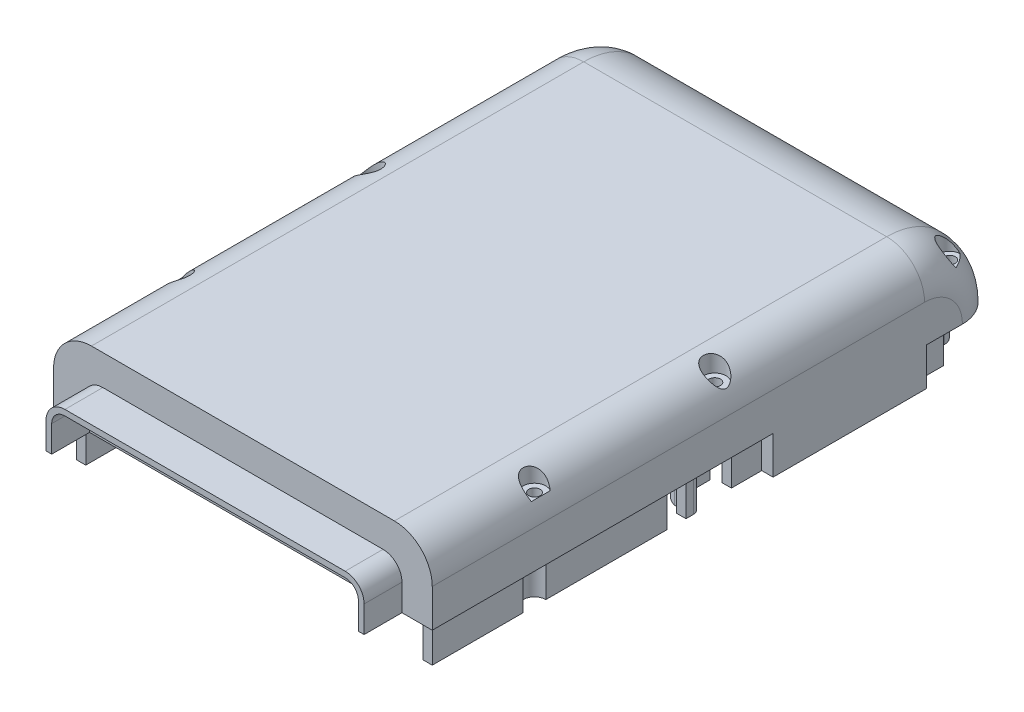
from build123d import *

# Parameters (mm, degrees)
SKETCH_1_W                  = 100
SKETCH_1_H                  = 150
EXTRUDE_1_DEPTH             = 20
FILLET_1_R                  = 10
FILLET_2_R                  = 20
SHELL_6_T                   = -3
SKETCH_5_W                  = 3
SKETCH_5_H                  = 40.5
EXTRUDE_2_DEPTH             = 10
SKETCH_6_W                  = 2.5
SKETCH_6_H                  = 56
EXTRUDE_3_DEPTH             = 10
EXTRUDE_3_DIRECTION_2_REACH = 94.331
EXTRUDE_4_DEPTH             = 11
EXTRUDE_4_DIRECTION_2_REACH = 94.331
EXTRUDE_13_REACH            = 94.331
SKETCH_23_R                 = 3
EXTRUDE_5_REACH             = 94.331
EXTRUDE_6_REACH             = 94.331
CUT_EXTRUDE_1_DEPTH         = 10
CUT_EXTRUDE_1_DEPTH_BACK    = 93.330926563
SKETCH_11_R                 = 1.5
SKETCH_11_R_2               = 1.485350611
EXTRUDE_7_DEPTH             = 10
SKETCH_15_R                 = 3
CUT_EXTRUDE_4_DEPTH         = 5
SKETCH_16_R                 = 2.8
CUT_EXTRUDE_5_DEPTH         = 8
EXTRUDE_11_DEPTH            = 3
SKETCH_19_W                 = 10
SKETCH_19_H                 = 3
EXTRUDE_9_DEPTH             = 12
CUT_EXTRUDE_6_REACH         = 152.603
SKETCH_21_W                 = 1.5
SKETCH_21_H                 = 16.986459988
SKETCH_21_H_2               = 18.55
EXTRUDE_10_DEPTH            = 1.5
SKETCH_25_R                 = 12.6
SKETCH_25_R_2               = 9.6
EXTRUDE_14_DEPTH            = 10
CUT_EXTRUDE_8_DEPTH         = 1


with BuildPart() as part:
    # 草图1 → 凸台-拉伸1 (new body)
    with BuildSketch(Plane(origin=(0, 0, 0), x_dir=(1, 0, 0), z_dir=(0, 1, 0))):
        Rectangle(SKETCH_1_W, SKETCH_1_H)
    extrude(amount=EXTRUDE_1_DEPTH)

    # 圆角1
    fillet_1_edges = [part.edges().sort_by_distance(p)[0] for p in [
        (50, 20, 0),
        (-50, 20, 0),
        (-50, 10, -75),
        (50, 10, -75),
    ]]
    fillet(fillet_1_edges, radius=FILLET_1_R)

    # 圆角2
    # the kernel refuses this fillet: 20 mm, written as the material it takes off along each edge
    with BuildSketch(Plane(origin=(-50, 0, -55), x_dir=(0, 1, 0), z_dir=(0, 0, 1))) as fillet_2_piece_1:
        with BuildLine():
            CenterArc((10, -10), 10, 0, 90)
            Line((20, -10), (20, 0))
            Line((20, 0), (10, 0))
        make_face()
    revolve(axis=Axis((-50, 0, -55), (-1, 0, 0)), revolution_arc=90, mode=Mode.SUBTRACT)
    with BuildSketch(Plane(origin=(50, 0, -55), x_dir=(0, 0, -1), z_dir=(0, -1, 0))) as fillet_2_piece_2:
        with BuildLine():
            CenterArc((10, -10), 10, 0, 90)
            Line((20, -10), (20, 0))
            Line((20, 0), (10, 0))
        make_face()
    revolve(axis=Axis((50, 0, -55), (1, 0, 0)), revolution_arc=90, mode=Mode.SUBTRACT)
    with BuildSketch(Plane(origin=(50, 20, -75), x_dir=(0, -1, 0), z_dir=(-1, 0, 0))) as fillet_2_piece_3:
        with BuildLine():
            CenterArc((FILLET_2_R, FILLET_2_R), FILLET_2_R, 180, 90)
            Line((0, FILLET_2_R), (0, 0))
            Line((0, 0), (FILLET_2_R, 0))
        make_face()
    extrude(amount=100, mode=Mode.SUBTRACT)

    # 抽壳6
    shell_6_openings = [part.faces().sort_by_distance(p)[0] for p in [
        (0, 0, 0.208807955),
    ]]
    offset(amount=SHELL_6_T, openings=shell_6_openings)

    # 草图5 → 凸台-拉伸2 (add)
    with BuildSketch(Plane.XZ):
        with Locations((48.5, -35.25)):
            Rectangle(SKETCH_5_W, SKETCH_5_H)
        with Locations((-48.5, -35.25)):
            Rectangle(SKETCH_5_W, SKETCH_5_H)
    extrude(amount=EXTRUDE_2_DEPTH)

    # 草图6 → 凸台-拉伸3 (add)
    with BuildSketch(Plane.XZ):
        with Locations((45.75, -35)):
            Rectangle(SKETCH_6_W, SKETCH_6_H)
        with Locations((-45.75, -35)):
            Rectangle(SKETCH_6_W, SKETCH_6_H)
    extrude(amount=EXTRUDE_3_DEPTH)

    # 草图6 → 凸台-拉伸3 direction 2 (add, up to next)
    with BuildSketch(Plane.XZ, mode=Mode.PRIVATE) as extrude_3_direction_2_sk1:
        with Locations((45.75, -35)):
            Rectangle(SKETCH_6_W, SKETCH_6_H)
    extrude_3_direction_2_tool1 = extrude(extrude_3_direction_2_sk1.sketch, amount=-EXTRUDE_3_DIRECTION_2_REACH, mode=Mode.PRIVATE) - part.part
    # 草图6 → 凸台-拉伸3 direction 2 (add, up to next)
    with BuildSketch(Plane.XZ, mode=Mode.PRIVATE) as extrude_3_direction_2_sk2:
        with Locations((-45.75, -35)):
            Rectangle(SKETCH_6_W, SKETCH_6_H)
    extrude_3_direction_2_tool2 = extrude(extrude_3_direction_2_sk2.sketch, amount=-EXTRUDE_3_DIRECTION_2_REACH, mode=Mode.PRIVATE) - part.part
    add(extrude_3_direction_2_tool1.solids().sort_by_distance((45.75, 0, -35))[0])
    add(extrude_3_direction_2_tool2.solids().sort_by_distance((-45.75, 0, -35))[0])

    # 草图7 → 凸台-拉伸4 (add)
    with BuildSketch(Plane.XZ):
        with BuildLine():
            Line((-47, 39.5), (-47, 10.051578841))
            Line((-47, 10.051578841), (-44.5, 10))
            Line((-44.5, 10), (-44.5, 40.101020514))
            ThreePointArc((-44.5, 40.101020514), (-41.5, 45), (-44.5, 49.898979486))
            Line((-44.5, 49.898979486), (-44.5, 72))
            Line((-44.5, 72), (-47, 72))
            Line((-47, 72), (-47, 50.5))
            Line((-47, 50.5), (-47, 48))
            ThreePointArc((-47, 48), (-44, 45), (-47, 42))
            Line((-47, 42), (-47, 39.5))
        make_face()
        with BuildLine():
            Line((47, 72), (44.5, 72))
            Line((44.5, 72), (44.5, 69))
            Line((44.5, 69), (44.5, 49.898979486))
            ThreePointArc((44.5, 49.898979486), (41.5, 45), (44.5, 40.101020514))
            Line((44.5, 40.101020514), (44.5, 10))
            Line((44.5, 10), (47, 10.051578841))
            Line((47, 10.051578841), (47, 39.5))
            Line((47, 39.5), (47, 42))
            ThreePointArc((47, 42), (44, 45), (47, 48))
            Line((47, 48), (47, 50.5))
            Line((47, 50.5), (47, 72))
        make_face()
        with BuildLine():
            Line((47, 3), (47, 5))
            Line((47, 5), (44.485471899, 5))
            ThreePointArc((44.485471899, 5), (43.979696953, 4.052146831), (43.061891595, 3.493696072))
            ThreePointArc((43.061891595, 3.493696072), (42.750579363, 3.430103155), (42.433163974, 3.41572138))
            ThreePointArc((42.433163974, 3.41572138), (39.8250351, 1.859129053), (38.8, -1))
            Line((38.8, -1), (38.8, -7))
            Line((38.8, -7), (41.3, -7))
            Line((41.3, -7), (41.3, -1))
            ThreePointArc((41.3, -1), (41.885786438, 0.414213562), (43.3, 1))
            Line((43.3, 1), (45, 1))
            ThreePointArc((45, 1), (46.414213562, 1.585786438), (47, 3))
        make_face()
        with BuildLine():
            Line((-44.485471899, 5), (-47, 5))
            Line((-47, 5), (-47, 3))
            ThreePointArc((-47, 3), (-46.414213562, 1.585786438), (-45, 1))
            Line((-45, 1), (-43.3, 1))
            ThreePointArc((-43.3, 1), (-41.885786438, 0.414213562), (-41.3, -1))
            Line((-41.3, -1), (-41.3, -7))
            Line((-41.3, -7), (-38.8, -7))
            Line((-38.8, -7), (-38.8, -1))
            ThreePointArc((-38.8, -1), (-39.8250351, 1.859129053), (-42.433163974, 3.41572138))
            ThreePointArc((-42.433163974, 3.41572138), (-42.750579363, 3.430103155), (-43.061891595, 3.493696072))
            ThreePointArc((-43.061891595, 3.493696072), (-43.979696953, 4.052146831), (-44.485471899, 5))
        make_face()
        Polygon((-13.6, -12), (-13.6, -58.5), (-31.6, -58.5), (-31.6, -61), (-11.1, -61), (-11.1, -9.5), (-31.6, -9.5), (-31.6, -12), align=None)
        Polygon((31.6, -61), (11.1, -61), (11.1, -9.5), (31.6, -9.5), (31.6, -12), (13.6, -12), (13.6, -58.5), (31.6, -58.5), align=None)
        with BuildLine():
            Line((38.3, -69.5), (0, -69.5))
            Line((0, -69.5), (0, -72))
            Line((0, -72), (38.3, -72))
            ThreePointArc((38.3, -72), (40.421320344, -71.121320344), (41.3, -69))
            Line((41.3, -69), (41.3, -63.5))
            Line((41.3, -63.5), (38.8, -63.5))
            Line((38.8, -63.5), (38.8, -69))
            ThreePointArc((38.8, -69), (38.653553391, -69.353553391), (38.3, -69.5))
        make_face()
        with BuildLine():
            Line((0, -72), (0, -69.5))
            Line((0, -69.5), (-38.3, -69.5))
            ThreePointArc((-38.3, -69.5), (-38.653553391, -69.353553391), (-38.8, -69))
            Line((-38.8, -69), (-38.8, -63.5))
            Line((-38.8, -63.5), (-41.3, -63.5))
            Line((-41.3, -63.5), (-41.3, -69))
            ThreePointArc((-41.3, -69), (-40.421320344, -71.121320344), (-38.3, -72))
            Line((-38.3, -72), (0, -72))
        make_face()
    extrude(amount=EXTRUDE_4_DEPTH)

    # 草图7 → 凸台-拉伸4 direction 2 (add, up to next)
    with BuildSketch(Plane.XZ, mode=Mode.PRIVATE) as extrude_4_direction_2_sk1:
        with BuildLine():
            Line((-47, 39.5), (-47, 10.051578841))
            Line((-47, 10.051578841), (-44.5, 10))
            Line((-44.5, 10), (-44.5, 40.101020514))
            ThreePointArc((-44.5, 40.101020514), (-41.5, 45), (-44.5, 49.898979486))
            Line((-44.5, 49.898979486), (-44.5, 72))
            Line((-44.5, 72), (-47, 72))
            Line((-47, 72), (-47, 50.5))
            Line((-47, 50.5), (-47, 48))
            ThreePointArc((-47, 48), (-44, 45), (-47, 42))
            Line((-47, 42), (-47, 39.5))
        make_face()
    extrude_4_direction_2_tool1 = extrude(extrude_4_direction_2_sk1.sketch, amount=-EXTRUDE_4_DIRECTION_2_REACH, mode=Mode.PRIVATE) - part.part
    # 草图7 → 凸台-拉伸4 direction 2 (add, up to next)
    with BuildSketch(Plane.XZ, mode=Mode.PRIVATE) as extrude_4_direction_2_sk2:
        with BuildLine():
            Line((47, 72), (44.5, 72))
            Line((44.5, 72), (44.5, 69))
            Line((44.5, 69), (44.5, 49.898979486))
            ThreePointArc((44.5, 49.898979486), (41.5, 45), (44.5, 40.101020514))
            Line((44.5, 40.101020514), (44.5, 10))
            Line((44.5, 10), (47, 10.051578841))
            Line((47, 10.051578841), (47, 39.5))
            Line((47, 39.5), (47, 42))
            ThreePointArc((47, 42), (44, 45), (47, 48))
            Line((47, 48), (47, 50.5))
            Line((47, 50.5), (47, 72))
        make_face()
    extrude_4_direction_2_tool2 = extrude(extrude_4_direction_2_sk2.sketch, amount=-EXTRUDE_4_DIRECTION_2_REACH, mode=Mode.PRIVATE) - part.part
    # 草图7 → 凸台-拉伸4 direction 2 (add, up to next)
    with BuildSketch(Plane.XZ, mode=Mode.PRIVATE) as extrude_4_direction_2_sk3:
        with BuildLine():
            Line((47, 3), (47, 5))
            Line((47, 5), (44.485471899, 5))
            ThreePointArc((44.485471899, 5), (43.979696953, 4.052146831), (43.061891595, 3.493696072))
            ThreePointArc((43.061891595, 3.493696072), (42.750579363, 3.430103155), (42.433163974, 3.41572138))
            ThreePointArc((42.433163974, 3.41572138), (39.8250351, 1.859129053), (38.8, -1))
            Line((38.8, -1), (38.8, -7))
            Line((38.8, -7), (41.3, -7))
            Line((41.3, -7), (41.3, -1))
            ThreePointArc((41.3, -1), (41.885786438, 0.414213562), (43.3, 1))
            Line((43.3, 1), (45, 1))
            ThreePointArc((45, 1), (46.414213562, 1.585786438), (47, 3))
        make_face()
    extrude_4_direction_2_tool3 = extrude(extrude_4_direction_2_sk3.sketch, amount=-EXTRUDE_4_DIRECTION_2_REACH, mode=Mode.PRIVATE) - part.part
    # 草图7 → 凸台-拉伸4 direction 2 (add, up to next)
    with BuildSketch(Plane.XZ, mode=Mode.PRIVATE) as extrude_4_direction_2_sk4:
        with BuildLine():
            Line((-44.485471899, 5), (-47, 5))
            Line((-47, 5), (-47, 3))
            ThreePointArc((-47, 3), (-46.414213562, 1.585786438), (-45, 1))
            Line((-45, 1), (-43.3, 1))
            ThreePointArc((-43.3, 1), (-41.885786438, 0.414213562), (-41.3, -1))
            Line((-41.3, -1), (-41.3, -7))
            Line((-41.3, -7), (-38.8, -7))
            Line((-38.8, -7), (-38.8, -1))
            ThreePointArc((-38.8, -1), (-39.8250351, 1.859129053), (-42.433163974, 3.41572138))
            ThreePointArc((-42.433163974, 3.41572138), (-42.750579363, 3.430103155), (-43.061891595, 3.493696072))
            ThreePointArc((-43.061891595, 3.493696072), (-43.979696953, 4.052146831), (-44.485471899, 5))
        make_face()
    extrude_4_direction_2_tool4 = extrude(extrude_4_direction_2_sk4.sketch, amount=-EXTRUDE_4_DIRECTION_2_REACH, mode=Mode.PRIVATE) - part.part
    # 草图7 → 凸台-拉伸4 direction 2 (add, up to next)
    with BuildSketch(Plane.XZ, mode=Mode.PRIVATE) as extrude_4_direction_2_sk5:
        Polygon((-13.6, -12), (-13.6, -58.5), (-31.6, -58.5), (-31.6, -61), (-11.1, -61), (-11.1, -9.5), (-31.6, -9.5), (-31.6, -12), align=None)
    extrude_4_direction_2_tool5 = extrude(extrude_4_direction_2_sk5.sketch, amount=-EXTRUDE_4_DIRECTION_2_REACH, mode=Mode.PRIVATE) - part.part
    # 草图7 → 凸台-拉伸4 direction 2 (add, up to next)
    with BuildSketch(Plane.XZ, mode=Mode.PRIVATE) as extrude_4_direction_2_sk6:
        Polygon((31.6, -61), (11.1, -61), (11.1, -9.5), (31.6, -9.5), (31.6, -12), (13.6, -12), (13.6, -58.5), (31.6, -58.5), align=None)
    extrude_4_direction_2_tool6 = extrude(extrude_4_direction_2_sk6.sketch, amount=-EXTRUDE_4_DIRECTION_2_REACH, mode=Mode.PRIVATE) - part.part
    # 草图7 → 凸台-拉伸4 direction 2 (add, up to next)
    with BuildSketch(Plane.XZ, mode=Mode.PRIVATE) as extrude_4_direction_2_sk7:
        with BuildLine():
            Line((38.3, -69.5), (0, -69.5))
            Line((0, -69.5), (0, -72))
            Line((0, -72), (38.3, -72))
            ThreePointArc((38.3, -72), (40.421320344, -71.121320344), (41.3, -69))
            Line((41.3, -69), (41.3, -63.5))
            Line((41.3, -63.5), (38.8, -63.5))
            Line((38.8, -63.5), (38.8, -69))
            ThreePointArc((38.8, -69), (38.653553391, -69.353553391), (38.3, -69.5))
        make_face()
    extrude_4_direction_2_tool7 = extrude(extrude_4_direction_2_sk7.sketch, amount=-EXTRUDE_4_DIRECTION_2_REACH, mode=Mode.PRIVATE) - part.part
    # 草图7 → 凸台-拉伸4 direction 2 (add, up to next)
    with BuildSketch(Plane.XZ, mode=Mode.PRIVATE) as extrude_4_direction_2_sk8:
        with BuildLine():
            Line((0, -72), (0, -69.5))
            Line((0, -69.5), (-38.3, -69.5))
            ThreePointArc((-38.3, -69.5), (-38.653553391, -69.353553391), (-38.8, -69))
            Line((-38.8, -69), (-38.8, -63.5))
            Line((-38.8, -63.5), (-41.3, -63.5))
            Line((-41.3, -63.5), (-41.3, -69))
            ThreePointArc((-41.3, -69), (-40.421320344, -71.121320344), (-38.3, -72))
            Line((-38.3, -72), (0, -72))
        make_face()
    extrude_4_direction_2_tool8 = extrude(extrude_4_direction_2_sk8.sketch, amount=-EXTRUDE_4_DIRECTION_2_REACH, mode=Mode.PRIVATE) - part.part
    add(extrude_4_direction_2_tool1.solids().sort_by_distance((-45.429605, 0, 41.181899))[0])
    add(extrude_4_direction_2_tool2.solids().sort_by_distance((45.429605, 0, 41.181899))[0])
    add(extrude_4_direction_2_tool3.solids().sort_by_distance((44.15, 0, 1.145341))[0])
    add(extrude_4_direction_2_tool4.solids().sort_by_distance((-41.783015, 0, 0.516985))[0])
    add(extrude_4_direction_2_tool5.solids().sort_by_distance((-13.045699, 0, -35.25))[0])
    add(extrude_4_direction_2_tool6.solids().sort_by_distance((21.35, 0, -60.445699))[0])
    add(extrude_4_direction_2_tool7.solids().sort_by_distance((22.827309, 0, -70.191937))[0])
    add(extrude_4_direction_2_tool8.solids().sort_by_distance((-22.827309, 0, -70.191937))[0])

    # 草图23 → 凸台-拉伸13 (add, up to next)
    with BuildSketch(Plane(origin=(0, 0, 0), x_dir=(-1, 0, 0), z_dir=(0, -1, 0)), mode=Mode.PRIVATE) as extrude_13_sk1:
        with Locations((47, -45)):
            Circle(SKETCH_23_R)
    extrude_13_tool1 = extrude(extrude_13_sk1.sketch, amount=-EXTRUDE_13_REACH, mode=Mode.PRIVATE) - part.part
    # 草图23 → 凸台-拉伸13 (add, up to next)
    with BuildSketch(Plane(origin=(0, 0, 0), x_dir=(-1, 0, 0), z_dir=(0, -1, 0)), mode=Mode.PRIVATE) as extrude_13_sk2:
        with Locations((-47, -45)):
            Circle(SKETCH_23_R)
    extrude_13_tool2 = extrude(extrude_13_sk2.sketch, amount=-EXTRUDE_13_REACH, mode=Mode.PRIVATE) - part.part
    add(extrude_13_tool1.solids().sort_by_distance((-47, 0, 45))[0])
    add(extrude_13_tool2.solids().sort_by_distance((47, 0, 45))[0])

    # 草图9 → 凸台-拉伸5 (add, up to next)
    with BuildSketch(Plane(origin=(0, 0, 0), x_dir=(-1, 0, 0), z_dir=(0, -1, 0)), mode=Mode.PRIVATE) as extrude_5_sk1:
        with BuildLine():
            Line((-47, 7), (-47, -3))
            ThreePointArc((-47, -3), (-46.414213562, -1.585786438), (-45, -1))
            Line((-45, -1), (-42.8, -1))
            ThreePointArc((-42.8, -1), (-41.385786438, -0.414213562), (-40.8, 1))
            Line((-40.8, 1), (-40.8, 13))
            ThreePointArc((-40.8, 13), (-41.385786438, 14.414213562), (-42.8, 15))
            Line((-42.8, 15), (-44.5, 15))
            Line((-44.5, 15), (-44.5, 7))
            Line((-44.5, 7), (-47, 7))
        make_face()
    extrude_5_tool1 = extrude(extrude_5_sk1.sketch, amount=-EXTRUDE_5_REACH, mode=Mode.PRIVATE) - part.part
    # 草图9 → 凸台-拉伸5 (add, up to next)
    with BuildSketch(Plane(origin=(0, 0, 0), x_dir=(-1, 0, 0), z_dir=(0, -1, 0)), mode=Mode.PRIVATE) as extrude_5_sk2:
        with BuildLine():
            ThreePointArc((40.8, 1), (41.385786438, -0.414213562), (42.8, -1))
            Line((42.8, -1), (45, -1))
            ThreePointArc((45, -1), (46.414213562, -1.585786438), (47, -3))
            Line((47, -3), (47, 7))
            Line((47, 7), (44.5, 7))
            Line((44.5, 7), (44.5, 15))
            Line((44.5, 15), (42.8, 15))
            ThreePointArc((42.8, 15), (41.385786438, 14.414213562), (40.8, 13))
            Line((40.8, 13), (40.8, 1))
        make_face()
    extrude_5_tool2 = extrude(extrude_5_sk2.sketch, amount=-EXTRUDE_5_REACH, mode=Mode.PRIVATE) - part.part
    add(extrude_5_tool1.solids().sort_by_distance((43.514927, 0, -5.886278))[0])
    add(extrude_5_tool2.solids().sort_by_distance((-43.514927, 0, -5.886278))[0])

    # 草图10 → 凸台-拉伸6 (add, up to next)
    with BuildSketch(Plane.XZ, mode=Mode.PRIVATE) as extrude_6_sk1:
        with BuildLine():
            Line((-40, -72), (-40, -62))
            ThreePointArc((-40, -62), (-40.585786438, -60.585786438), (-42, -60))
            Line((-42, -60), (-44.5, -60))
            Line((-44.5, -60), (-44.5, -63))
            Line((-44.5, -63), (-47, -63))
            Line((-47, -63), (-47, -65))
            Line((-47, -65), (-47, -72))
            Line((-47, -72), (-40, -72))
        make_face()
    extrude_6_tool1 = extrude(extrude_6_sk1.sketch, amount=-EXTRUDE_6_REACH, mode=Mode.PRIVATE) - part.part
    # 草图10 → 凸台-拉伸6 (add, up to next)
    with BuildSketch(Plane.XZ, mode=Mode.PRIVATE) as extrude_6_sk2:
        with BuildLine():
            Line((47, -63), (47, -65))
            Line((47, -65), (47, -72))
            Line((47, -72), (40, -72))
            Line((40, -72), (40, -62))
            ThreePointArc((40, -62), (40.585786438, -60.585786438), (42, -60))
            Line((42, -60), (44.5, -60))
            Line((44.5, -60), (44.5, -63))
            Line((44.5, -63), (47, -63))
        make_face()
    extrude_6_tool2 = extrude(extrude_6_sk2.sketch, amount=-EXTRUDE_6_REACH, mode=Mode.PRIVATE) - part.part
    add(extrude_6_tool1.solids().sort_by_distance((-43.311558, 0, -66.509203))[0])
    add(extrude_6_tool2.solids().sort_by_distance((43.311558, 0, -66.509203))[0])

    # 草图11 → 切除-拉伸1 (cut, two sides: drawn at the far end of the back side and taken through both)
    with BuildSketch(Plane.XZ.offset(-CUT_EXTRUDE_1_DEPTH_BACK)):
        with Locations(Location((-45.65, -66, 0), (0, 0, 222.332802962))):
            Circle(SKETCH_11_R)
        with Locations(Location((-45.605138498, -4, 0), (0, 0, 90))):
            Circle(SKETCH_11_R)
        with Locations(Location((-47, 45, 0), (0, 0, 90))):
            Circle(SKETCH_11_R_2)
        with Locations(Location((47, 45, 0), (0, 0, 90))):
            Circle(SKETCH_11_R)
        with Locations(Location((45.605138498, -4, 0), (0, 0, 90))):
            Circle(SKETCH_11_R)
        with Locations(Location((45.65, -66, 0), (0, 0, 317.667197038))):
            Circle(SKETCH_11_R)
    extrude(amount=CUT_EXTRUDE_1_DEPTH + CUT_EXTRUDE_1_DEPTH_BACK, mode=Mode.SUBTRACT)

    # 草图14 → 凸台-拉伸7 (add)
    with BuildSketch(Plane.XY.offset(75)):
        with BuildLine():
            Line((-42, 0), (-42, 7))
            ThreePointArc((-42, 7), (-40.535533906, 10.535533906), (-37, 12))
            Line((-37, 12), (37, 12))
            ThreePointArc((37, 12), (40.535533906, 10.535533906), (42, 7))
            Line((42, 7), (42, 0))
            Line((42, 0), (40.5, 0))
            Line((40.5, 0), (40.5, 1.5))
            Line((40.5, 1.5), (40.5, 7))
            ThreePointArc((40.5, 7), (39.474873734, 9.474873734), (37, 10.5))
            Line((37, 10.5), (-37, 10.5))
            ThreePointArc((-37, 10.5), (-39.474873734, 9.474873734), (-40.5, 7))
            Line((-40.5, 7), (-40.5, 1.5))
            Line((-40.5, 1.5), (-40.5, 0))
            Line((-40.5, 0), (-42, 0))
        make_face()
    extrude(amount=EXTRUDE_7_DEPTH)

    # 草图15 → 切除-拉伸4 (cut)
    with BuildSketch(Plane(origin=(0, 20, 0), x_dir=(1, 0, 0), z_dir=(0, 1, 0))):
        with Locations(Location((45.605138498, 4, 0), (0, 0, 270))):
            Circle(SKETCH_15_R)
        with Locations(Location((-45.605138498, 4, 0), (0, 0, 270))):
            Circle(SKETCH_15_R)
        with Locations((-47, -45)):
            Circle(SKETCH_15_R)
        with Locations((47, -45)):
            Circle(SKETCH_15_R)
    extrude(amount=-CUT_EXTRUDE_4_DEPTH, mode=Mode.SUBTRACT)

    # 草图16 → 切除-拉伸5 (cut)
    with BuildSketch(Plane(origin=(0, 20, 0), x_dir=(1, 0, 0), z_dir=(0, 1, 0))):
        with Locations((-45.65, 66)):
            Circle(SKETCH_16_R)
        with Locations((45.65, 66)):
            Circle(SKETCH_16_R)
    extrude(amount=-CUT_EXTRUDE_5_DEPTH, mode=Mode.SUBTRACT)

    # 草图22 → 凸台-拉伸11 (add)
    with BuildSketch(Plane(origin=(0, -9, 0), x_dir=(-1, 0, 0), z_dir=(0, -1, 0))):
        Polygon((44.5, 15), (41.3, 15), (41.3, 12), (13.6, 12), (13.6, 58.5), (41.3, 58.5), (41.3, 55.469397887), (44.5, 55.469397887), align=None)
        Polygon((-41.3, 15), (-41.3, 12), (-13.6, 12), (-13.6, 58.5), (-41.3, 58.5), (-41.3, 55.469397887), (-44.5, 55.469397887), (-44.5, 15), align=None)
    extrude(amount=-EXTRUDE_11_DEPTH)

    # 草图19 → 凸台-拉伸9 (add)
    with BuildSketch(Plane.XZ.offset(9)):
        with Locations((-26.4, -57)):
            Rectangle(SKETCH_19_W, SKETCH_19_H)
        with Locations((26.5, -57)):
            Rectangle(SKETCH_19_W, SKETCH_19_H)
    extrude(amount=EXTRUDE_9_DEPTH)

    # 草图20 → 切除-拉伸6 (cut, up to next)
    with BuildSketch(Plane.XY.offset(-55.5), mode=Mode.PRIVATE) as cut_extrude_6_sk1:
        with BuildLine():
            ThreePointArc((31.5, -19.2), (26.5, -14.2), (21.5, -19.2))
            Line((21.5, -19.2), (21.5, -21))
            Line((21.5, -21), (31.5, -21))
            Line((31.5, -21), (31.5, -19.2))
        make_face()
    cut_extrude_6_tool1 = extrude(cut_extrude_6_sk1.sketch, amount=-CUT_EXTRUDE_6_REACH, mode=Mode.PRIVATE) & part.part
    # 草图20 → 切除-拉伸6 (cut, up to next)
    with BuildSketch(Plane.XY.offset(-55.5), mode=Mode.PRIVATE) as cut_extrude_6_sk2:
        with BuildLine():
            ThreePointArc((-21.4, -20.8), (-26.4, -15.8), (-31.4, -20.8))
            Line((-31.4, -20.8), (-31.4, -21.67750727))
            Line((-31.4, -21.67750727), (-21.404001601, -21.67750727))
            Line((-21.404001601, -21.67750727), (-21.4, -20.8))
        make_face()
    cut_extrude_6_tool2 = extrude(cut_extrude_6_sk2.sketch, amount=-CUT_EXTRUDE_6_REACH, mode=Mode.PRIVATE) & part.part
    add(cut_extrude_6_tool1.solids().sort_by_distance((26.5, -18.027773, -55.5))[0], mode=Mode.SUBTRACT)
    add(cut_extrude_6_tool2.solids().sort_by_distance((-26.400183, -19.145568, -55.5))[0], mode=Mode.SUBTRACT)


with BuildPart() as cut_extrude_6_piece_1:
    # of the separate pieces the step leaves, piece 1, a body of its own (cut_extrude_6_pieces)
    add(part.part.solids().sort_by_distance((40, 0, -75))[0])

    # 草图21 → 凸台-拉伸10 (add)
    with BuildSketch(Plane(origin=(0, 0, -61), x_dir=(-1, 0, 0), z_dir=(0, 0, -1))):
        with Locations((-26.5, -8.493229994)):
            Rectangle(SKETCH_21_W, SKETCH_21_H)
        with Locations((26.5, -9.275)):
            Rectangle(SKETCH_21_W, SKETCH_21_H_2)
    extrude(amount=EXTRUDE_10_DEPTH)

    # 草图25 → 凸台-拉伸14 (add)
    with BuildSketch(Plane.XZ.offset(-17)):
        with Locations(Location((0, 55, 0), (0, 0, 270))):
            Circle(SKETCH_25_R)
        with Locations(Location((0, 55, 0), (0, 0, 270))):
            Circle(SKETCH_25_R_2, mode=Mode.SUBTRACT)
    extrude(amount=EXTRUDE_14_DEPTH)

    # 草图26 → 切除-拉伸8 (cut)
    with BuildSketch(Plane.XZ.offset(11)):
        Polygon((27.25, -61), (31.6, -61), (31.6, -58.5), (31.5, -58.5), (21.5, -58.5), (13.6, -58.5), (13.6, -12), (31.6, -12), (31.6, -9.5), (11.1, -9.5), (11.1, -61), (25.75, -61), align=None)
        Polygon((-13.6, -12), (-13.6, -58.5), (-21.4, -58.5), (-31.4, -58.5), (-31.6, -58.5), (-31.6, -61), (-27.25, -61), (-25.75, -61), (-11.1, -61), (-11.1, -9.5), (-31.6, -9.5), (-31.6, -12), align=None)
    extrude(amount=-CUT_EXTRUDE_8_DEPTH, mode=Mode.SUBTRACT)


with BuildPart() as cut_extrude_6_piece_2:
    # of the separate pieces the step leaves, piece 2, a body of its own (cut_extrude_6_pieces)
    add(part.part.solids().sort_by_distance((-21.4, -21, -55.5))[0])


solid = Compound([cut_extrude_6_piece_1.part, cut_extrude_6_piece_2.part])
